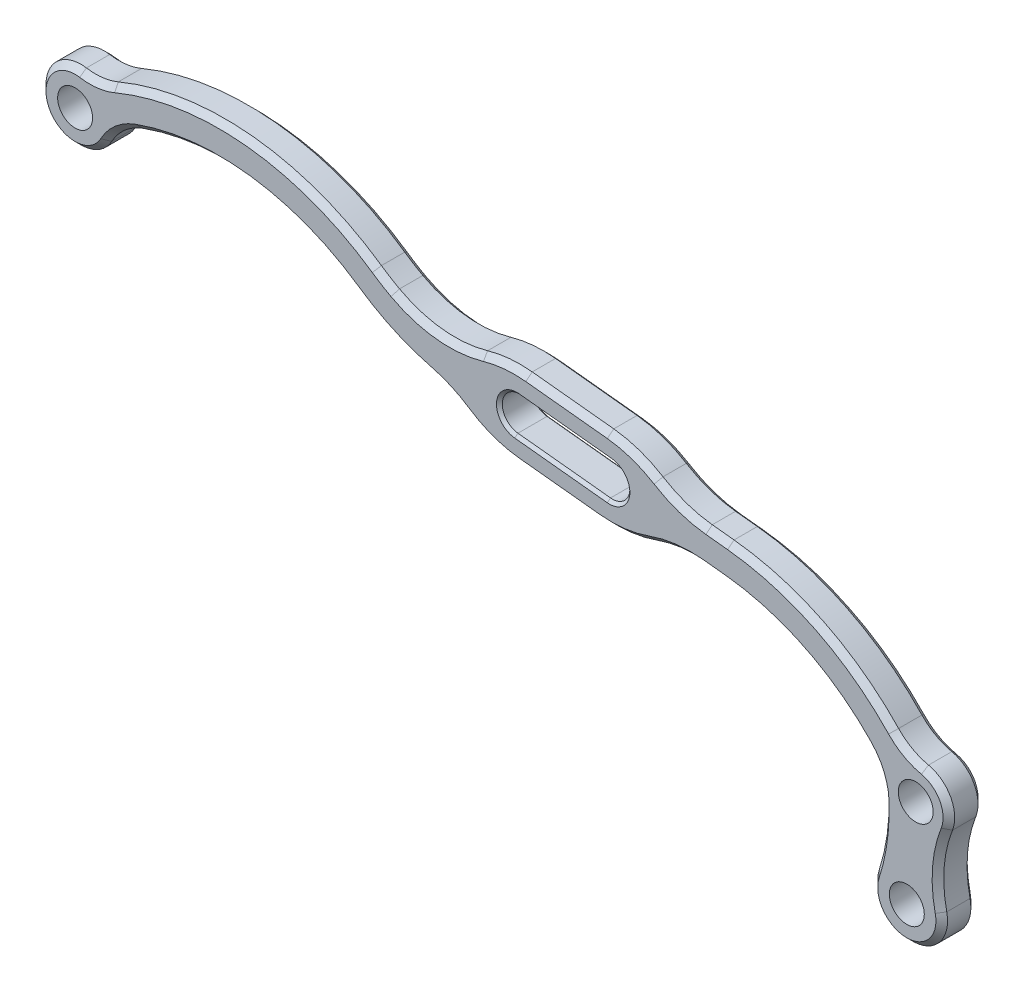
from build123d import *

# Parameters (mm, degrees)
SKETCH1_R             = 1.5
BOSS_EXTRUDE1_DEPTH   = 3
SKETCH1_R_2           = 3
BOSS_EXTRUDE1_2_DEPTH = 3
EXTRUDE_THIN1_DEPTH   = 3
BOSS_EXTRUDE2_DEPTH   = 3
FILLET1_R             = 10
FILLET2_R             = 10
FILLET3_R             = 5
CUT_EXTRUDE2_DEPTH    = 3
CHAMFER1_SIZE         = 0.25
FILLET4_SIZE          = 0.5


with BuildPart() as part:
    # Sketch1 → Boss-Extrude1 (new body)
    with BuildSketch(Plane.XY.offset(5)):
        with BuildLine():
            ThreePointArc((109.185458354, -4.000646729), (108.5228767, -5.038603319), (108.360025672, -6.259196566))
            ThreePointArc((108.360025672, -6.259196566), (108.310958913, -9.715379327), (107.5808738, -13.093926729))
            ThreePointArc((107.5808738, -13.093926729), (110.294106049, -17.011846795), (113.365194477, -13.367653777))
            ThreePointArc((113.365194477, -13.367653777), (113.140936636, -10.174222756), (113.854520762, -7.053471091))
            ThreePointArc((113.854520762, -7.053471091), (112.759359915, -3.631536319), (109.185458354, -4.000646729))
        make_face()
        with Locations((111.199707869, -6.016905367)):
            Circle(SKETCH1_R, mode=Mode.SUBTRACT)
        with Locations((110.435914095, -14.015200256)):
            Circle(SKETCH1_R, mode=Mode.SUBTRACT)
    extrude(amount=BOSS_EXTRUDE1_DEPTH)



with BuildPart() as body_2:
    # Sketch1 → Boss-Extrude1 2 (new body)
    with BuildSketch(Plane.XY.offset(5)):
        with Locations((39, 9.5)):
            Circle(SKETCH1_R_2)
        with Locations((39, 9.5)):
            Circle(SKETCH1_R, mode=Mode.SUBTRACT)
    extrude(amount=BOSS_EXTRUDE1_2_DEPTH)


with BuildPart() as part_1:
    add(part.part)

    add(body_2.part)  # Extrude-Thin1 merges body 2
    # Sketch3 → Extrude-Thin1 (add)
    with BuildSketch(Plane.XY.offset(5)):
        with BuildLine():
            ThreePointArc((41.593001143, 9.173549984), (52.518716901, 11.608273697), (63.103455441, 7.966508408))
            ThreePointArc((63.103455441, 7.966508408), (67.496674945, 5.672669193), (72.321939964, 4.541787477))
            Line((72.321939964, 4.541787477), (94.785034536, 2.180821101))
            ThreePointArc((94.785034536, 2.180821101), (102.503244611, -0.298409767), (108.581874595, -5.661954302))
            Line((108.581874595, -5.661954302), (110.985068552, -3.8662208))
            ThreePointArc((110.985068552, -3.8662208), (103.98579607, 2.309662542), (95.098619926, 5.164386787))
            Line((95.098619926, 5.164386787), (72.635525354, 7.525353163))
            ThreePointArc((72.635525354, 7.525353163), (68.541425508, 8.484874068), (64.813903968, 10.431131266))
            ThreePointArc((64.813903968, 10.431131266), (52.686795037, 14.60356162), (40.169022902, 11.814058641))
            Line((40.169022902, 11.814058641), (41.593001143, 9.173549984))
        make_face()
    extrude(amount=EXTRUDE_THIN1_DEPTH)

    # Sketch4 → Boss-Extrude2 (add)
    with BuildSketch(Plane.XY.offset(8)):
        Polygon((71.8385125, 9.620139149), (90.734428512, 7.634098347), (90.002729269, 0.672445079), (71.106813257, 2.658485881), align=None)
        with BuildLine():
            Line((77.099325998, 7.05618881), (85.055501161, 6.219961104))
            ThreePointArc((85.055501161, 6.219961104), (86.390491309, 4.571385566), (84.741915771, 3.236395418))
            Line((84.741915771, 3.236395418), (76.785740608, 4.072623124))
            ThreePointArc((76.785740608, 4.072623124), (75.45075046, 5.721198662), (77.099325998, 7.05618881))
        make_face(mode=Mode.SUBTRACT)
    extrude(amount=-BOSS_EXTRUDE2_DEPTH)

    # Fillet1
    # the kernel refuses this fillet: 10 mm, written as the material it takes off along each edge
    with BuildSketch(Plane(origin=(90.002729269, 0.672445079, 23), x_dir=(0.10452846326752661, 0.9945218953682867, 0), z_dir=(0, 0, -1))) as fillet1_piece_1:
        with BuildLine():
            CenterArc((10, -6), FILLET1_R, 143.130102354, 36.869897646)
            Line((0, -6), (-0.2, -6))
            Line((-0.2, -6), (-0.2, 0))
            Line((-0.2, 0), (0, 0.2))
            ThreePointArc((0, 0.2), (1, 0.2), (1.84, 0.12))
            Line((1.84, 0.12), (2, 0))
        make_face()
    extrude(amount=33, mode=Mode.SUBTRACT)
    with BuildSketch(Plane(origin=(90.734428512, 7.634098347, 23), x_dir=(-0.10452846326775972, -0.9945218953682622, 0), z_dir=(0, 0, -1))) as fillet1_piece_2:
        with BuildLine():
            CenterArc((10, 6), FILLET1_R, 180, 36.869897646)
            Line((0, 6), (-0.2, 6))
            Line((-0.2, 6), (-0.2, 0))
            Line((-0.2, 0), (0, -0.2))
            ThreePointArc((0, -0.2), (1, -0.2), (1.84, -0.12))
            Line((1.84, -0.12), (2, 0))
        make_face()
    extrude(amount=33, mode=Mode.SUBTRACT)
    with BuildSketch(Plane(origin=(71.106813257, 2.658485881, 23.085820281), x_dir=(0.9945218953682746, -0.10452846326764255, 0), z_dir=(0, 0, -1))) as fillet1_piece_3:
        with BuildLine():
            CenterArc((6.034328112, -10), FILLET1_R, 90, 37.116152296)
            Line((0, -2.025861537), (-0.120686562, -1.866378767))
            ThreePointArc((-0.120686562, -1.866378767), (-0.2, -1.012930768), (-0.2, 0))
            Line((-0.2, 0), (0, 0.2))
            Line((0, 0.2), (6.034328112, 0.2))
            Line((6.034328112, 0.2), (6.034328112, 0))
        make_face()
    extrude(amount=33.171640562, mode=Mode.SUBTRACT)
    with BuildSketch(Plane(origin=(71.8385125, 9.620139149, 22.897832051), x_dir=(-0.10452846326748966, -0.9945218953682906, 0), z_dir=(0, 0, -1))) as fillet1_piece_4:
        with BuildLine():
            CenterArc((10, -5.95913282), FILLET1_R, 143.422234679, 36.577765321)
            Line((0, -5.95913282), (-0.2, -5.95913282))
            Line((-0.2, -5.95913282), (-0.2, 0))
            Line((-0.2, 0), (0, 0.2))
            ThreePointArc((0, 0.2), (0.984756046, 0.2), (1.808902334, 0.119182656))
            Line((1.808902334, 0.119182656), (1.969512093, 0))
        make_face()
    extrude(amount=32.795664101, mode=Mode.SUBTRACT)

    # Fillet2
    fillet2_edges = [part_1.edges().sort_by_distance(p)[0] for p in [
        (71.632642427, 7.66141625, 6.5),
        (90.525371585, 5.645054556, 6.5),
        (90.211786196, 2.66148887, 6.5),
        (71.31857345, 4.673249537, 6.5),
    ]]
    fillet(fillet2_edges, radius=FILLET2_R)

    # Fillet3
    fillet3_edges = [part_1.edges().sort_by_distance(p)[0] for p in [
        (108.409742984, -5.435015389, 6.5),
        (110.509408047, -3.251767729, 6.5),
        (41.997837089, 9.386101864, 6.5),
        (40.597330828, 12.039396429, 6.5),
    ]]
    fillet(fillet3_edges, radius=FILLET3_R)

    # Sketch4<2> → Cut-Extrude2 (cut)
    with BuildSketch(Plane.XY.offset(8)):
        with BuildLine():
            Line((77.099325998, 7.05618881), (85.055501161, 6.219961104))
            ThreePointArc((85.055501161, 6.219961104), (86.390491309, 4.571385566), (84.741915771, 3.236395418))
            Line((84.741915771, 3.236395418), (76.785740608, 4.072623124))
            ThreePointArc((76.785740608, 4.072623124), (75.45075046, 5.721198662), (77.099325998, 7.05618881))
        make_face()
    extrude(amount=-CUT_EXTRUDE2_DEPTH, mode=Mode.SUBTRACT)

    # Chamfer1
    chamfer1_edges = [part_1.edges().sort_by_distance(p)[0] for p in [
        (81.077413579, 6.638074957, 8),
        (86.390491309, 4.571385566, 5),
        (80.76382819, 3.654509271, 5),
        (75.45075046, 5.721198662, 5),
        (81.077413579, 6.638074957, 5),
        (75.45075046, 5.721198662, 8),
        (80.76382819, 3.654509271, 8),
        (86.390491309, 4.571385566, 8),
    ]]
    chamfer(chamfer1_edges, length=CHAMFER1_SIZE)

    # Fillet4
    fillet4_edges = [part_1.edges().sort_by_distance(p)[0] for p in [
        (80.571841293, 1.663671348, 5),
        (80.571841293, 1.663671348, 8),
        (81.266148853, 8.62925464, 8),
        (75.831843077, 9.0125273, 8),
        (86.285883658, 1.317701678, 8),
        (81.266148853, 8.62925464, 5),
        (74.746621894, 2.571133627, 5),
        (86.964648505, 7.775717809, 5),
        (74.746621894, 2.571133627, 8),
        (66.167237141, 6.222318503, 8),
        (66.167237141, 6.222318503, 5),
        (65.577546873, 9.931341027, 8),
        (65.577546873, 9.931341027, 5),
        (75.831843077, 9.0125273, 5),
        (86.285883658, 1.317701678, 5),
        (53.814375327, 14.513121306, 5),
        (86.964648505, 7.775717809, 8),
        (71.097481671, 4.489860289, 5),
        (54.015350868, 11.469337492, 8),
        (71.097481671, 4.489860289, 8),
        (70.068678069, 8.317079629, 5),
        (70.068678069, 8.317079629, 8),
        (90.66440994, 2.359315815, 8),
        (90.66440994, 2.359315815, 5),
        (91.030929726, 5.846518637, 8),
        (91.030929726, 5.846518637, 5),
        (93.849865119, 2.279111367, 8),
        (101.439573781, 0.26418945, 5),
        (101.439573781, 0.26418945, 8),
        (108.258346947, -10.132192641, 5),
        (108.258346947, -10.132192641, 8),
        (102.785056404, 2.945662756, 5),
        (102.785056404, 2.945662756, 8),
        (36.30994009, 8.172002379, 5),
        (36.30994009, 8.172002379, 8),
        (94.163450509, 5.262677053, 5),
        (108.019819848, -5.334888598, 8),
        (108.019819848, -5.334888598, 5),
        (110.407911183, -2.704163701, 8),
        (110.407911183, -2.704163701, 5),
        (42.773374787, 9.487301339, 8),
        (42.773374787, 9.487301339, 5),
        (40.865302991, 12.434666794, 8),
        (94.163450509, 5.262677053, 8),
        (40.865302991, 12.434666794, 5),
        (53.814375327, 14.513121306, 8),
        (54.015350868, 11.469337492, 5),
        (93.849865119, 2.279111367, 5),
        (113.710131038, -4.667729504, 5),
        (110.294106049, -17.011846795, 8),
        (113.710131038, -4.667729504, 8),
        (113.140936636, -10.174222756, 5),
        (110.294106049, -17.011846795, 5),
        (113.140936636, -10.174222756, 8),
    ]]
    chamfer(fillet4_edges, length=FILLET4_SIZE)


solid = part_1.part
